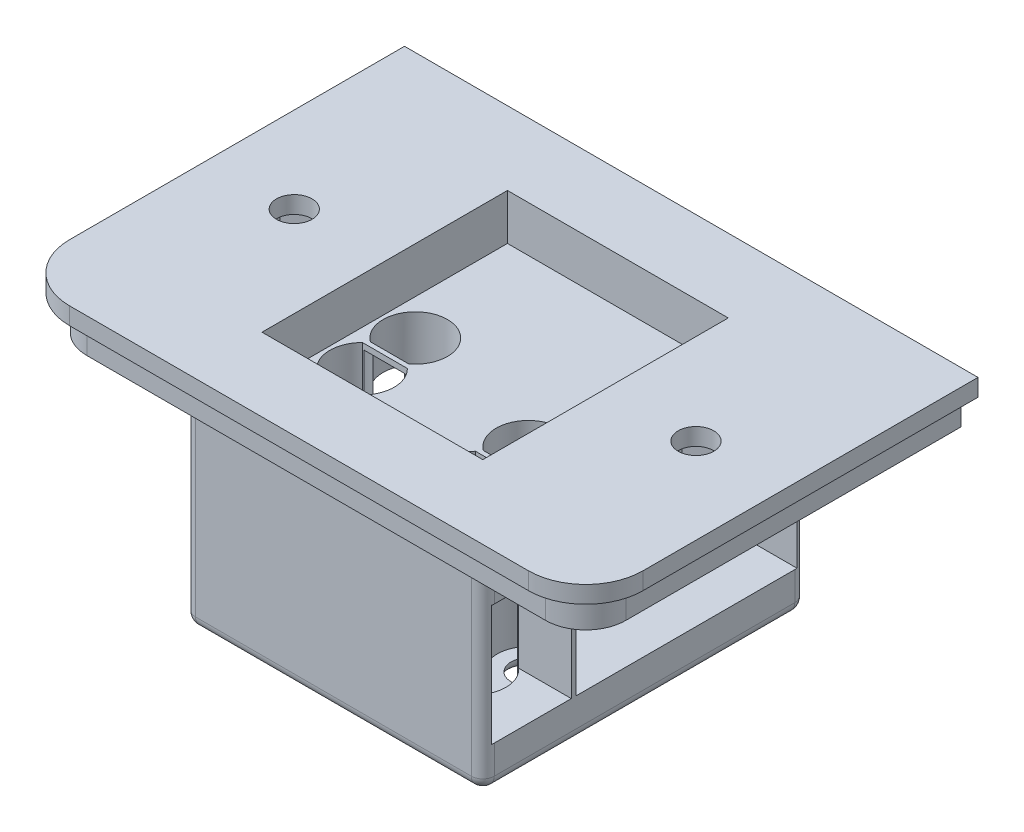
from build123d import *

# Parameters (mm, degrees)
SKETCH1_W                = 26.05
SKETCH1_H                = 28.2
BOSS_EXTRUDE1_DEPTH      = 8
SKETCH2_W                = 19.25
SKETCH2_H                = 21.4
CUT_EXTRUDE1_DEPTH       = 4
CUT_EXTRUDE4_DEPTH       = 39.598477949
CUT_EXTRUDE4_DEPTH_BACK  = 1
SKETCH4_W                = 3.25
SKETCH4_H                = 3.4
CUT_EXTRUDE7_DEPTH       = 0.5
CUT_EXTRUDE7_DEPTH_BACK  = 16.5
SKETCH7_W                = 13.73
SKETCH7_H                = 28.2
BOSS_EXTRUDE2_DEPTH      = 11
CUT_EXTRUDE8_REACH       = 42.864
BOSS_EXTRUDE3_DEPTH      = 0.5
SKETCH9_W                = 26.05
SKETCH9_H                = 28.2
BOSS_EXTRUDE4_DEPTH      = 3
BOSS_EXTRUDE6_DEPTH      = 14
BOSS_EXTRUDE6_DEPTH_BACK = 3.5
SKETCH10_W               = 6.22
SKETCH10_H               = 0.8
SKETCH10_W_2             = 6.1
CUT_EXTRUDE9_DEPTH       = 0.5
CUT_EXTRUDE9_DEPTH_BACK  = 16
CUT_EXTRUDE10_REACH      = 45.759
SKETCH11_R               = 1.5
FILLET1_R                = 0.5
SKETCH12_W               = 26.05
SKETCH12_H               = 28.2
BOSS_EXTRUDE7_DEPTH      = 1.5
BOSS_EXTRUDE8_DEPTH      = 3
FILLET3_R                = 1
CUT_EXTRUDE12_DEPTH      = 4
CUT_EXTRUDE13_REACH      = 108.185
SKETCH16_R               = 1.55
SKETCH17_W               = 8.975
SKETCH17_H               = 10
BOSS_EXTRUDE9_DEPTH      = 3
FILLET4_R                = 0.5
FILLET5_R                = 0.5
FILLET6_R                = 0.5
FILLET7_R                = 1
SKETCH19_W               = 50
SKETCH19_H               = 65.8
CUT_EXTRUDE15_DEPTH      = 107.484274094


with BuildPart() as part:
    # Sketch1 → Boss-Extrude1 (new body)
    with BuildSketch(Plane(origin=(0, 0, 0), x_dir=(1, 0, 0), z_dir=(0, 1, 0))):
        with Locations((13.025, 14.1)):
            Rectangle(SKETCH1_W, SKETCH1_H)
    extrude(amount=-BOSS_EXTRUDE1_DEPTH)

    # Sketch2 → Cut-Extrude1 (cut)
    with BuildSketch(Plane(origin=(0, 0, 0), x_dir=(1, 0, 0), z_dir=(0, 1, 0))):
        with Locations((13.025, 14.1)):
            Rectangle(SKETCH2_W, SKETCH2_H)
    extrude(amount=-CUT_EXTRUDE1_DEPTH, mode=Mode.SUBTRACT)

    # Sketch4 → Cut-Extrude4 (cut, two sides: drawn at the far end of the back side and taken through both)
    with BuildSketch(Plane(origin=(0, -4, 0), x_dir=(1, 0, 0), z_dir=(0, 1, 0)).offset(-CUT_EXTRUDE4_DEPTH_BACK)):
        with Locations((19.65, 5.715)):
            Rectangle(SKETCH4_W, SKETCH4_H)
        with Locations((6.52, 13.645)):
            Rectangle(SKETCH4_W, SKETCH4_H)
        with Locations((19.65, 10.365)):
            Rectangle(SKETCH4_W, SKETCH4_H)
        with Locations((6.52, 8.995)):
            Rectangle(SKETCH4_W, SKETCH4_H)
    extrude(amount=CUT_EXTRUDE4_DEPTH + CUT_EXTRUDE4_DEPTH_BACK, mode=Mode.SUBTRACT)

    # Sketch6 → Cut-Extrude7 (cut, two sides: drawn at the far end of the back side and taken through both)
    with BuildSketch(Plane(origin=(0, -5, 0), x_dir=(1, 0, 0), z_dir=(0, 1, 0)).offset(-CUT_EXTRUDE7_DEPTH_BACK)):
        with BuildLine():
            ThreePointArc((5.147274609, 11.32), (6.52, 6.295), (7.892725391, 11.32))
            ThreePointArc((7.892725391, 11.32), (6.52, 16.345), (5.147274609, 11.32))
        make_face()
        with BuildLine():
            ThreePointArc((21.022725391, 8.04), (19.65, 13.065), (18.277274609, 8.04))
            ThreePointArc((18.277274609, 8.04), (19.65, 3.015), (21.022725391, 8.04))
        make_face()
    extrude(amount=CUT_EXTRUDE7_DEPTH + CUT_EXTRUDE7_DEPTH_BACK, mode=Mode.SUBTRACT)

    # Sketch7 → Boss-Extrude2 (add)
    with BuildSketch(Plane.XZ.offset(8)):
        with Locations((13.085, -14.1)):
            Rectangle(SKETCH7_W, SKETCH7_H)
    extrude(amount=BOSS_EXTRUDE2_DEPTH)

    # Sketch6<4> → Cut-Extrude8 (cut, up to next)
    with BuildSketch(Plane(origin=(0, -5, 0), x_dir=(1, 0, 0), z_dir=(0, 1, 0)), mode=Mode.PRIVATE) as cut_extrude8_sk1:
        with BuildLine():
            ThreePointArc((5.147274609, 11.32), (6.52, 6.295), (7.892725391, 11.32))
            ThreePointArc((7.892725391, 11.32), (6.52, 16.345), (5.147274609, 11.32))
        make_face()
    cut_extrude8_tool1 = extrude(cut_extrude8_sk1.sketch, amount=-CUT_EXTRUDE8_REACH, mode=Mode.PRIVATE) & part.part
    # Sketch6<4> → Cut-Extrude8 (cut, up to next)
    with BuildSketch(Plane(origin=(0, -5, 0), x_dir=(1, 0, 0), z_dir=(0, 1, 0)), mode=Mode.PRIVATE) as cut_extrude8_sk2:
        with BuildLine():
            ThreePointArc((21.022725391, 8.04), (19.65, 13.065), (18.277274609, 8.04))
            ThreePointArc((18.277274609, 8.04), (19.65, 3.015), (21.022725391, 8.04))
        make_face()
    cut_extrude8_tool2 = extrude(cut_extrude8_sk2.sketch, amount=-CUT_EXTRUDE8_REACH, mode=Mode.PRIVATE) & part.part
    add(cut_extrude8_tool1.solids().sort_by_distance((6.52, -5, -11.32))[0], mode=Mode.SUBTRACT)
    add(cut_extrude8_tool2.solids().sort_by_distance((19.65, -5, -8.04))[0], mode=Mode.SUBTRACT)

    # Sketch8 → Boss-Extrude3 (add)
    with BuildSketch(Plane.XZ.offset(19)):
        with BuildLine():
            Line((19.95, 0), (19.95, -3.031718427))
            ThreePointArc((19.95, -3.031718427), (17.089061496, -4.859667328), (18.277274609, -8.04))
            ThreePointArc((18.277274609, -8.04), (17.089061496, -11.220332672), (19.95, -13.048281573))
            Line((19.95, -13.048281573), (19.95, -28.2))
            Line((19.95, -28.2), (26.05, -28.2))
            Line((26.05, -28.2), (26.05, 0))
            Line((26.05, 0), (19.95, 0))
        make_face()
        with BuildLine():
            Line((0, -28.2), (6.22, -28.2))
            Line((6.22, -28.2), (6.22, -16.328281573))
            ThreePointArc((6.22, -16.328281573), (9.080938504, -14.500332672), (7.892725391, -11.32))
            ThreePointArc((7.892725391, -11.32), (9.080938504, -8.139667328), (6.22, -6.311718427))
            Line((6.22, -6.311718427), (6.22, 0))
            Line((6.22, 0), (0, 0))
            Line((0, 0), (0, -28.2))
        make_face()
    extrude(amount=-BOSS_EXTRUDE3_DEPTH)

    # Sketch9 → Boss-Extrude4 (add)
    with BuildSketch(Plane.XZ.offset(19)):
        with Locations((13.025, -14.1)):
            Rectangle(SKETCH9_W, SKETCH9_H)
    extrude(amount=BOSS_EXTRUDE4_DEPTH)

    # Sketch10 → Boss-Extrude6 (add, two sides: drawn at the far end of the back side and taken through both)
    with BuildSketch(Plane(origin=(0, -18.5, 0), x_dir=(1, 0, 0), z_dir=(0, 1, 0)).offset(-BOSS_EXTRUDE6_DEPTH_BACK)):
        with Locations((3.11, 27.8)):
            Rectangle(SKETCH10_W, SKETCH10_H)
        with BuildLine():
            Line((26.05, 7.71875313), (17.840311244, 7.71875313))
            ThreePointArc((17.840311244, 7.71875313), (18.050706456, 7.890375867), (18.277274609, 8.04))
            ThreePointArc((18.277274609, 8.04), (18.214035404, 8.078516744), (18.151876173, 8.11875313))
            Line((18.151876173, 8.11875313), (26.05, 8.11875313))
            Line((26.05, 8.11875313), (26.05, 7.71875313))
        make_face()
        with BuildLine():
            Line((0, 10.99875313), (0, 11.39875313))
            Line((0, 11.39875313), (8.018123827, 11.39875313))
            ThreePointArc((8.018123827, 11.39875313), (7.955964596, 11.358516744), (7.892725391, 11.32))
            ThreePointArc((7.892725391, 11.32), (8.119293544, 11.170375867), (8.329688756, 10.99875313))
            Line((8.329688756, 10.99875313), (0, 10.99875313))
        make_face()
        with Locations((3.11, 0.4)):
            Rectangle(SKETCH10_W, SKETCH10_H)
        with Locations((23, 0.4)):
            Rectangle(SKETCH10_W_2, SKETCH10_H)
        with Locations((23, 27.8)):
            Rectangle(SKETCH10_W_2, SKETCH10_H)
    extrude(amount=BOSS_EXTRUDE6_DEPTH + BOSS_EXTRUDE6_DEPTH_BACK)

    # Sketch6<5> → Cut-Extrude9 (cut, two sides: drawn at the far end of the back side and taken through both)
    with BuildSketch(Plane(origin=(0, -5, 0), x_dir=(1, 0, 0), z_dir=(0, 1, 0)).offset(-CUT_EXTRUDE9_DEPTH_BACK)):
        with BuildLine():
            ThreePointArc((5.147274609, 11.32), (6.52, 6.295), (7.892725391, 11.32))
            ThreePointArc((7.892725391, 11.32), (6.52, 16.345), (5.147274609, 11.32))
        make_face()
        with BuildLine():
            ThreePointArc((21.022725391, 8.04), (19.65, 13.065), (18.277274609, 8.04))
            ThreePointArc((18.277274609, 8.04), (19.65, 3.015), (21.022725391, 8.04))
        make_face()
    extrude(amount=CUT_EXTRUDE9_DEPTH + CUT_EXTRUDE9_DEPTH_BACK, mode=Mode.SUBTRACT)

    # Sketch11 → Cut-Extrude10 (cut, up to next)
    with BuildSketch(Plane(origin=(0, -21, 0), x_dir=(1, 0, 0), z_dir=(0, 1, 0)), mode=Mode.PRIVATE) as cut_extrude10_sk1:
        with Locations(Location((6.52, 13.645, 0), (0, 0, 270))):
            Circle(SKETCH11_R)
    cut_extrude10_tool1 = extrude(cut_extrude10_sk1.sketch, amount=-CUT_EXTRUDE10_REACH, mode=Mode.PRIVATE) & part.part
    # Sketch11 → Cut-Extrude10 (cut, up to next)
    with BuildSketch(Plane(origin=(0, -21, 0), x_dir=(1, 0, 0), z_dir=(0, 1, 0)), mode=Mode.PRIVATE) as cut_extrude10_sk2:
        with Locations(Location((6.52, 8.995, 0), (0, 0, 270))):
            Circle(SKETCH11_R)
    cut_extrude10_tool2 = extrude(cut_extrude10_sk2.sketch, amount=-CUT_EXTRUDE10_REACH, mode=Mode.PRIVATE) & part.part
    # Sketch11 → Cut-Extrude10 (cut, up to next)
    with BuildSketch(Plane(origin=(0, -21, 0), x_dir=(1, 0, 0), z_dir=(0, 1, 0)), mode=Mode.PRIVATE) as cut_extrude10_sk3:
        with Locations(Location((19.65, 10.365, 0), (0, 0, 270))):
            Circle(SKETCH11_R)
    cut_extrude10_tool3 = extrude(cut_extrude10_sk3.sketch, amount=-CUT_EXTRUDE10_REACH, mode=Mode.PRIVATE) & part.part
    # Sketch11 → Cut-Extrude10 (cut, up to next)
    with BuildSketch(Plane(origin=(0, -21, 0), x_dir=(1, 0, 0), z_dir=(0, 1, 0)), mode=Mode.PRIVATE) as cut_extrude10_sk4:
        with Locations(Location((19.65, 5.715, 0), (0, 0, 270))):
            Circle(SKETCH11_R)
    cut_extrude10_tool4 = extrude(cut_extrude10_sk4.sketch, amount=-CUT_EXTRUDE10_REACH, mode=Mode.PRIVATE) & part.part
    add(cut_extrude10_tool1.solids().sort_by_distance((6.52, -21, -13.645))[0], mode=Mode.SUBTRACT)
    add(cut_extrude10_tool2.solids().sort_by_distance((6.52, -21, -8.995))[0], mode=Mode.SUBTRACT)
    add(cut_extrude10_tool3.solids().sort_by_distance((19.65, -21, -10.365))[0], mode=Mode.SUBTRACT)
    add(cut_extrude10_tool4.solids().sort_by_distance((19.65, -21, -5.715))[0], mode=Mode.SUBTRACT)

    # Fillet1
    fillet1_edges = [part.edges().sort_by_distance(p)[0] for p in [
        (21.275, -4.25, -4.015),
        (21.275, -4.25, -7.415),
        (18.025, -4.25, -7.415),
        (18.025, -4.25, -4.015),
        (21.275, -4.25, -8.665),
        (21.275, -4.25, -12.065),
        (18.025, -4.25, -12.065),
        (18.025, -4.25, -8.665),
        (4.895, -4.25, -15.345),
        (4.895, -4.25, -11.945),
        (8.145, -4.25, -11.945),
        (8.145, -4.25, -15.345),
        (4.895, -4.25, -10.695),
        (4.895, -4.25, -7.295),
        (8.145, -4.25, -7.295),
        (8.145, -4.25, -10.695),
    ]]
    fillet(fillet1_edges, radius=FILLET1_R)

    # Sketch12 → Boss-Extrude7 (add)
    with BuildSketch(Plane(origin=(0, 0, 0), x_dir=(1, 0, 0), z_dir=(0, 1, 0))):
        with BuildLine():
            Line((-6.975, -3), (33.025, -3))
            ThreePointArc((33.025, -3), (36.560533906, -1.535533906), (38.025, 2))
            Line((38.025, 2), (38.025, 92))
            ThreePointArc((38.025, 92), (36.560533906, 95.535533906), (33.025, 97))
            Line((33.025, 97), (-6.975, 97))
            ThreePointArc((-6.975, 97), (-10.510533906, 95.535533906), (-11.975, 92))
            Line((-11.975, 92), (-11.975, 2))
            ThreePointArc((-11.975, 2), (-10.510533906, -1.535533906), (-6.975, -3))
        make_face()
        with Locations((13.025, 14.1)):
            Rectangle(SKETCH12_W, SKETCH12_H, mode=Mode.SUBTRACT)
    extrude(amount=-BOSS_EXTRUDE7_DEPTH)

    # Sketch13 → Boss-Extrude8 (add)
    with BuildSketch(Plane.XZ.offset(1.5)):
        with BuildLine():
            Line((-6.975, -95.5), (33.025, -95.5))
            ThreePointArc((33.025, -95.5), (35.499873734, -94.474873734), (36.525, -92))
            Line((36.525, -92), (36.525, -2))
            ThreePointArc((36.525, -2), (35.499873734, 0.474873734), (33.025, 1.5))
            Line((33.025, 1.5), (-6.975, 1.5))
            ThreePointArc((-6.975, 1.5), (-9.449873734, 0.474873734), (-10.475, -2))
            Line((-10.475, -2), (-10.475, -92))
            ThreePointArc((-10.475, -92), (-9.449873734, -94.474873734), (-6.975, -95.5))
        make_face()
        with BuildLine():
            Line((-8.975, -92), (-8.975, -2))
            ThreePointArc((-8.975, -2), (-8.389213562, -0.585786438), (-6.975, 0))
            Line((-6.975, 0), (33.025, 0))
            ThreePointArc((33.025, 0), (34.439213562, -0.585786438), (35.025, -2))
            Line((35.025, -2), (35.025, -92))
            ThreePointArc((35.025, -92), (34.439213562, -93.414213562), (33.025, -94))
            Line((33.025, -94), (-6.975, -94))
            ThreePointArc((-6.975, -94), (-8.389213562, -93.414213562), (-8.975, -92))
        make_face(mode=Mode.SUBTRACT)
    extrude(amount=BOSS_EXTRUDE8_DEPTH)

    # Fillet3
    # the kernel refuses this fillet: 1 mm, written as the material it takes off along each edge
    with BuildSketch(Plane(origin=(0, -4.5, 0), x_dir=(0, 0, -1), z_dir=(0, -1, 0)), Plane(origin=(26.05, -24.5, 0), x_dir=(0, 0, -1), z_dir=(0, 1, 0))) as fillet3_piece_1:
        with BuildLine():
            CenterArc((FILLET3_R, FILLET3_R), FILLET3_R, 180, 90)
            Line((0, FILLET3_R), (0, 0))
            Line((0, 0), (FILLET3_R, 0))
        make_face()
    extrude(amount=20, mode=Mode.SUBTRACT)
    with BuildSketch(Plane(origin=(0, -1.5, -28.2), x_dir=(0, 0, 1), z_dir=(0, -1, 0)), Plane(origin=(26.05, -24.5, -28.2), x_dir=(0, 0, 1), z_dir=(0, 1, 0))) as fillet3_piece_2:
        with BuildLine():
            CenterArc((FILLET3_R, -FILLET3_R), FILLET3_R, 90, 90)
            Line((0, -FILLET3_R), (0, 0))
            Line((0, 0), (FILLET3_R, 0))
        make_face()
    extrude(amount=23, mode=Mode.SUBTRACT)

    # Sketch15 → Cut-Extrude12 (cut)
    with BuildSketch(Plane.XZ.offset(8)):
        with BuildLine():
            Line((4.564246081, -10.99875313), (8.475753919, -10.99875313))
            ThreePointArc((8.475753919, -10.99875313), (6.52, -6.195), (4.564246081, -10.99875313))
        make_face()
        with BuildLine():
            Line((8.191638418, -11.39875313), (4.848361582, -11.39875313))
            ThreePointArc((4.848361582, -11.39875313), (6.52, -16.445), (8.191638418, -11.39875313))
        make_face()
        with BuildLine():
            Line((17.694246081, -7.71875313), (21.605753919, -7.71875313))
            ThreePointArc((21.605753919, -7.71875313), (19.65, -2.915), (17.694246081, -7.71875313))
        make_face()
        with BuildLine():
            Line((21.321638418, -8.11875313), (17.978361582, -8.11875313))
            ThreePointArc((17.978361582, -8.11875313), (19.65, -13.165), (21.321638418, -8.11875313))
        make_face()
    extrude(amount=-CUT_EXTRUDE12_DEPTH, mode=Mode.SUBTRACT)

    # Sketch16 → Cut-Extrude13 (cut, up to next)
    with BuildSketch(Plane.XZ.offset(1.5), mode=Mode.PRIVATE) as cut_extrude13_sk1:
        with Locations(Location((-4.4875, -14.1, 0), (0, 0, 270))):
            Circle(SKETCH16_R)
    cut_extrude13_tool1 = extrude(cut_extrude13_sk1.sketch, amount=-CUT_EXTRUDE13_REACH, mode=Mode.PRIVATE) & part.part
    # Sketch16 → Cut-Extrude13 (cut, up to next)
    with BuildSketch(Plane.XZ.offset(1.5), mode=Mode.PRIVATE) as cut_extrude13_sk2:
        with Locations(Location((30.5375, -14.1, 0), (0, 0, 270))):
            Circle(SKETCH16_R)
    cut_extrude13_tool2 = extrude(cut_extrude13_sk2.sketch, amount=-CUT_EXTRUDE13_REACH, mode=Mode.PRIVATE) & part.part
    add(cut_extrude13_tool1.solids().sort_by_distance((-4.4875, -1.5, -14.1))[0], mode=Mode.SUBTRACT)
    add(cut_extrude13_tool2.solids().sort_by_distance((30.5375, -1.5, -14.1))[0], mode=Mode.SUBTRACT)

    # Sketch17 → Boss-Extrude9 (add)
    # profile 1 of 2: a face of its own
    with BuildSketch(Plane.XZ.offset(1.5)):
        with Locations((-4.4875, -14.1)):
            Rectangle(SKETCH17_W, SKETCH17_H)
        Polygon((-1.5875, -12.425684219), (-4.4875, -10.751368439), (-7.3875, -12.425684219), (-7.3875, -15.774315781), (-4.4875, -17.448631561), (-1.5875, -15.774315781), align=None, mode=Mode.SUBTRACT)
    # profile 2 of 2: a face of its own
    with BuildSketch(Plane.XZ.offset(1.5)):
        with Locations((30.5375, -14.1)):
            Rectangle(SKETCH17_W, SKETCH17_H)
        Polygon((27.6375, -15.774315781), (27.6375, -12.425684219), (30.5375, -10.751368439), (33.4375, -12.425684219), (33.4375, -15.774315781), (30.5375, -17.448631561), align=None, mode=Mode.SUBTRACT)
    extrude(amount=BOSS_EXTRUDE9_DEPTH)

    # Fillet4
    fillet4_edges = [part.edges().sort_by_distance(p)[0] for p in [
        (-3.4875, -1.5, 0),
        (-8.975, -1.5, -5.55),
        (-8.389213562, -1.5, -0.585786438),
        (0, -1.5, -4.55),
        (-4.4875, -1.5, -9.1),
    ]]
    fillet(fillet4_edges, radius=FILLET4_R)

    # Fillet5
    fillet5_edges = [part.edges().sort_by_distance(p)[0] for p in [
        (-8.389213562, -1.5, -93.414213562),
        (13.025, -1.5, -94),
        (34.439213562, -1.5, -93.414213562),
        (35.025, -1.5, -55.55),
        (0, -1.5, -23.15),
        (13.025, -1.5, -28.2),
        (0.292893219, -1.5, -27.907106781),
        (25.757106781, -1.5, -27.907106781),
        (-8.975, -1.5, -55.55),
        (-4.4875, -1.5, -19.1),
        (26.05, -1.5, -23.15),
        (30.5375, -1.5, -19.1),
    ]]
    fillet(fillet5_edges, radius=FILLET5_R)

    # Fillet6
    fillet6_edges = [part.edges().sort_by_distance(p)[0] for p in [
        (26.05, -1.5, -4.55),
        (34.439213562, -1.5, -0.585786438),
        (29.5375, -1.5, 0),
        (35.025, -1.5, -5.55),
        (30.5375, -1.5, -9.1),
    ]]
    fillet(fillet6_edges, radius=FILLET6_R)

    # Fillet7
    # the kernel refuses this fillet: 1 mm, written as the material it takes off along each edge
    with BuildSketch(Plane(origin=(6.52, -22, -8.995), x_dir=(0, 0, 1), z_dir=(-1, 0, 0))) as fillet7_piece_1:
        with BuildLine():
            CenterArc((1.5 + FILLET7_R, FILLET7_R), FILLET7_R, 180, 90)
            Line((1.5, FILLET7_R), (1.5, 0))
            Line((1.5, 0), (1.5 + FILLET7_R, 0))
        make_face()
    revolve(axis=Axis((6.52, -22, -8.995), (0, 1, 0)), mode=Mode.SUBTRACT)
    with BuildSketch(Plane(origin=(6.52, -22, -13.645), x_dir=(0, 0, 1), z_dir=(-1, 0, 0))) as fillet7_piece_2:
        with BuildLine():
            CenterArc((1.5 + FILLET7_R, FILLET7_R), FILLET7_R, 180, 90)
            Line((1.5, FILLET7_R), (1.5, 0))
            Line((1.5, 0), (1.5 + FILLET7_R, 0))
        make_face()
    revolve(axis=Axis((6.52, -22, -13.645), (0, 1, 0)), mode=Mode.SUBTRACT)
    with BuildSketch(Plane(origin=(19.65, -22, -10.365), x_dir=(0, 0, 1), z_dir=(-1, 0, 0))) as fillet7_piece_3:
        with BuildLine():
            CenterArc((1.5 + FILLET7_R, FILLET7_R), FILLET7_R, 180, 90)
            Line((1.5, FILLET7_R), (1.5, 0))
            Line((1.5, 0), (1.5 + FILLET7_R, 0))
        make_face()
    revolve(axis=Axis((19.65, -22, -10.365), (0, 1, 0)), mode=Mode.SUBTRACT)
    with BuildSketch(Plane(origin=(19.65, -22, -5.715), x_dir=(0, 0, 1), z_dir=(-1, 0, 0))) as fillet7_piece_4:
        with BuildLine():
            CenterArc((1.5 + FILLET7_R, FILLET7_R), FILLET7_R, 180, 90)
            Line((1.5, FILLET7_R), (1.5, 0))
            Line((1.5, 0), (1.5 + FILLET7_R, 0))
        make_face()
    revolve(axis=Axis((19.65, -22, -5.715), (0, 1, 0)), mode=Mode.SUBTRACT)
    with BuildSketch(Plane(origin=(0, -22, -1), x_dir=(0, 1, 0), z_dir=(0, 0, -1))) as fillet7_piece_5:
        with BuildLine():
            CenterArc((FILLET7_R, FILLET7_R), FILLET7_R, 180, 90)
            Line((0, FILLET7_R), (0, 0))
            Line((0, 0), (FILLET7_R, 0))
        make_face()
    extrude(amount=26.2, mode=Mode.SUBTRACT)
    with BuildSketch(Plane(origin=(1, -22, 0), x_dir=(0, 1, 0), z_dir=(1, 0, 0)), Plane(origin=(1, -22, -28.2), x_dir=(0, 0, 1), z_dir=(1, 0, 0))) as fillet7_piece_6:
        with BuildLine():
            CenterArc((FILLET7_R, -FILLET7_R), FILLET7_R, 90, 90)
            Line((0, -FILLET7_R), (0, 0))
            Line((0, 0), (FILLET7_R, 0))
        make_face()
    extrude(amount=24.05, mode=Mode.SUBTRACT)
    with BuildSketch(Plane(origin=(26.05, -22, -1), x_dir=(0, 1, 0), z_dir=(0, 0, -1))) as fillet7_piece_7:
        with BuildLine():
            CenterArc((FILLET7_R, -FILLET7_R), FILLET7_R, 90, 90)
            Line((0, -FILLET7_R), (0, 0))
            Line((0, 0), (FILLET7_R, 0))
        make_face()
    extrude(amount=26.2, mode=Mode.SUBTRACT)
    with BuildSketch(Plane(origin=(25.05, -22, -27.2), x_dir=(0, 0, -1), z_dir=(-1, 0, 0))) as fillet7_piece_8:
        with BuildLine():
            CenterArc((1 - FILLET7_R, -FILLET7_R), FILLET7_R, 0, 90)
            Line((1 - FILLET7_R, 0), (1, 0))
            Line((1, 0), (1, -FILLET7_R))
        make_face()
    revolve(axis=Axis((25.05, -22, -27.2), (0, -1, 0)), revolution_arc=90, mode=Mode.SUBTRACT)
    with BuildSketch(Plane(origin=(1, -22, -27.2), x_dir=(0, 0, -1), z_dir=(1, 0, 0))) as fillet7_piece_9:
        with BuildLine():
            CenterArc((1 - FILLET7_R, FILLET7_R), FILLET7_R, 270, 90)
            Line((1, FILLET7_R), (1, 0))
            Line((1, 0), (1 - FILLET7_R, 0))
        make_face()
    revolve(axis=Axis((1, -22, -27.2), (0, 1, 0)), revolution_arc=90, mode=Mode.SUBTRACT)
    with BuildSketch(Plane(origin=(25.05, -22, -1), x_dir=(1, 0, 0), z_dir=(0, 0, -1))) as fillet7_piece_10:
        with BuildLine():
            CenterArc((1 - FILLET7_R, -FILLET7_R), FILLET7_R, 0, 90)
            Line((1 - FILLET7_R, 0), (1, 0))
            Line((1, 0), (1, -FILLET7_R))
        make_face()
    revolve(axis=Axis((25.05, -22, -1), (0, -1, 0)), revolution_arc=90, mode=Mode.SUBTRACT)
    with BuildSketch(Plane(origin=(1, -22, -1), x_dir=(-1, 0, 0), z_dir=(0, 0, -1))) as fillet7_piece_11:
        with BuildLine():
            CenterArc((1 - FILLET7_R, FILLET7_R), FILLET7_R, 270, 90)
            Line((1 - FILLET7_R, 0), (1, 0))
            Line((1, 0), (1, FILLET7_R))
        make_face()
    revolve(axis=Axis((1, -22, -1), (0, 1, 0)), revolution_arc=90, mode=Mode.SUBTRACT)

    # Sketch19 → Cut-Extrude15 (cut, through all)
    with BuildSketch(Plane(origin=(0, 0, 0), x_dir=(1, 0, 0), z_dir=(0, 1, 0))):
        with Locations((13.025, 64.1)):
            Rectangle(SKETCH19_W, SKETCH19_H)
    extrude(amount=-CUT_EXTRUDE15_DEPTH, mode=Mode.SUBTRACT)


solid = part.part
